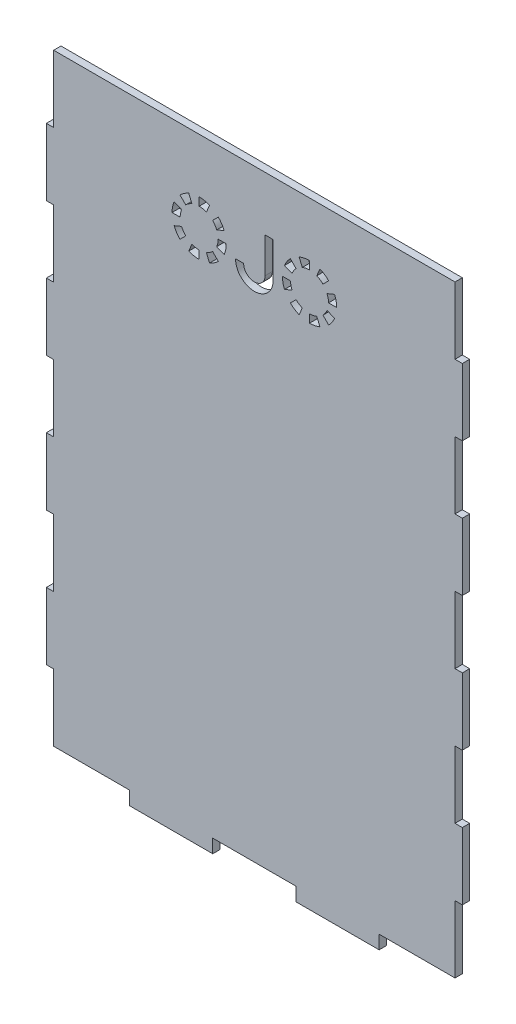
from build123d import *

# Parameters (mm, degrees)
BOSS_EXTRUDE2_DEPTH = 2.7


with BuildPart() as part:
    # Sketch1 → Boss-Extrude2 (new body)
    with BuildSketch(Plane.XY):
        Polygon((46.02, -108.65), (74, -108.65), (74, -83.95), (76.7, -83.95), (76.7, -59.25), (74, -59.25), (74, -34.55), (76.7, -34.55), (76.7, -9.85), (74, -9.85), (74, 14.85), (76.7, 14.85), (76.7, 39.55), (74, 39.55), (74, 64.25), (76.7, 64.25), (76.7, 88.95), (74, 88.95), (74, 113.65), (-74, 113.65), (-74, 88.95), (-76.7, 88.95), (-76.7, 64.25), (-74, 64.25), (-74, 39.55), (-76.7, 39.55), (-76.7, 14.85), (-74, 14.85), (-74, -9.85), (-76.7, -9.85), (-76.7, -34.55), (-74, -34.55), (-74, -59.25), (-76.7, -59.25), (-76.7, -61.75), (-76.7, -83.95), (-74, -83.95), (-74, -108.65), (-46.02, -108.65), (-46.02, -113.65), (-15.34, -113.65), (-15.34, -108.65), (15.34, -108.65), (15.34, -113.65), (46.02, -113.65), align=None)
        with BuildLine():
            Line((-13.280766207, 76.578932188), (-15.402086551, 78.700252532))
            ThreePointArc((-15.402086551, 78.700252532), (-16.462842388, 77.829712714), (-17.673049993, 77.182843272))
            Line((-17.673049993, 77.182843272), (-16.524999695, 74.411204675))
            ThreePointArc((-16.524999695, 74.411204675), (-14.796131689, 75.335303877), (-13.280766207, 76.578932188))
        make_face(mode=Mode.SUBTRACT)
        with BuildLine():
            Line((-11.113038694, 79.823165676), (-13.884677292, 80.971215973))
            ThreePointArc((-13.884677292, 80.971215973), (-13.486337056, 82.284367746), (-13.351834019, 83.65))
            Line((-13.351834019, 83.65), (-10.351834019, 83.65))
            ThreePointArc((-10.351834019, 83.65), (-10.543981215, 81.69909678), (-11.113038694, 79.823165676))
        make_face(mode=Mode.SUBTRACT)
        with BuildLine():
            Line((-11.113038694, 87.476834324), (-13.884677292, 86.328784027))
            ThreePointArc((-13.884677292, 86.328784027), (-14.531546733, 87.538991631), (-15.402086551, 88.599747468))
            Line((-15.402086551, 88.599747468), (-13.280766207, 90.721067812))
            ThreePointArc((-13.280766207, 90.721067812), (-12.037137896, 89.20570233), (-11.113038694, 87.476834324))
        make_face(mode=Mode.SUBTRACT)
        with BuildLine():
            Line((-16.524999695, 92.888795325), (-17.673049993, 90.117156728))
            ThreePointArc((-17.673049993, 90.117156728), (-18.986201765, 90.515496963), (-20.351834019, 90.65))
            Line((-20.351834019, 90.65), (-20.351834019, 93.65))
            ThreePointArc((-20.351834019, 93.65), (-18.400930799, 93.457852804), (-16.524999695, 92.888795325))
        make_face(mode=Mode.SUBTRACT)
        with BuildLine():
            Line((-23.030618046, 90.117156728), (-24.178668343, 92.888795325))
            ThreePointArc((-24.178668343, 92.888795325), (-25.907536349, 91.964696123), (-27.422901831, 90.721067812))
            Line((-27.422901831, 90.721067812), (-25.301581487, 88.599747468))
            ThreePointArc((-25.301581487, 88.599747468), (-24.24082565, 89.470287286), (-23.030618046, 90.117156728))
        make_face(mode=Mode.SUBTRACT)
        with BuildLine():
            Line((-26.818990747, 86.328784027), (-29.590629344, 87.476834324))
            ThreePointArc((-29.590629344, 87.476834324), (-30.159686823, 85.60090322), (-30.351834019, 83.65))
            Line((-30.351834019, 83.65), (-27.351834019, 83.65))
            ThreePointArc((-27.351834019, 83.65), (-27.217330982, 85.015632254), (-26.818990747, 86.328784027))
        make_face(mode=Mode.SUBTRACT)
        with BuildLine():
            Line((-26.818990747, 80.971215973), (-29.590629344, 79.823165676))
            ThreePointArc((-29.590629344, 79.823165676), (-28.666530142, 78.09429767), (-27.422901831, 76.578932188))
            Line((-27.422901831, 76.578932188), (-25.301581487, 78.700252532))
            ThreePointArc((-25.301581487, 78.700252532), (-26.172121305, 79.761008369), (-26.818990747, 80.971215973))
        make_face(mode=Mode.SUBTRACT)
        with BuildLine():
            Line((-23.030618046, 77.182843272), (-24.178668343, 74.411204675))
            ThreePointArc((-24.178668343, 74.411204675), (-22.302737239, 73.842147196), (-20.351834019, 73.65))
            Line((-20.351834019, 73.65), (-20.351834019, 76.65))
            ThreePointArc((-20.351834019, 76.65), (-21.717466273, 76.784503037), (-23.030618046, 77.182843272))
        make_face(mode=Mode.SUBTRACT)
        with BuildLine():
            Line((23.030618046, 77.182843272), (24.178668343, 74.411204675))
            ThreePointArc((24.178668343, 74.411204675), (22.302737239, 73.842147196), (20.351834019, 73.65))
            Line((20.351834019, 73.65), (20.351834019, 76.65))
            ThreePointArc((20.351834019, 76.65), (21.717466273, 76.784503037), (23.030618046, 77.182843272))
        make_face(mode=Mode.SUBTRACT)
        with BuildLine():
            Line((26.818990747, 80.971215973), (29.590629344, 79.823165676))
            ThreePointArc((29.590629344, 79.823165676), (28.666530142, 78.09429767), (27.422901831, 76.578932188))
            Line((27.422901831, 76.578932188), (25.301581487, 78.700252532))
            ThreePointArc((25.301581487, 78.700252532), (26.172121305, 79.761008369), (26.818990747, 80.971215973))
        make_face(mode=Mode.SUBTRACT)
        with BuildLine():
            Line((26.818990747, 86.328784027), (29.590629344, 87.476834324))
            ThreePointArc((29.590629344, 87.476834324), (30.159686823, 85.60090322), (30.351834019, 83.65))
            Line((30.351834019, 83.65), (27.351834019, 83.65))
            ThreePointArc((27.351834019, 83.65), (27.217330982, 85.015632254), (26.818990747, 86.328784027))
        make_face(mode=Mode.SUBTRACT)
        with BuildLine():
            Line((23.030618046, 90.117156728), (24.178668343, 92.888795325))
            ThreePointArc((24.178668343, 92.888795325), (25.907536349, 91.964696123), (27.422901831, 90.721067812))
            Line((27.422901831, 90.721067812), (25.301581487, 88.599747468))
            ThreePointArc((25.301581487, 88.599747468), (24.24082565, 89.470287286), (23.030618046, 90.117156728))
        make_face(mode=Mode.SUBTRACT)
        with BuildLine():
            Line((16.524999695, 92.888795325), (17.673049993, 90.117156728))
            ThreePointArc((17.673049993, 90.117156728), (18.986201765, 90.515496963), (20.351834019, 90.65))
            Line((20.351834019, 90.65), (20.351834019, 93.65))
            ThreePointArc((20.351834019, 93.65), (18.400930799, 93.457852804), (16.524999695, 92.888795325))
        make_face(mode=Mode.SUBTRACT)
        with BuildLine():
            Line((11.113038694, 87.476834324), (13.884677292, 86.328784027))
            ThreePointArc((13.884677292, 86.328784027), (14.531546733, 87.538991631), (15.402086551, 88.599747468))
            Line((15.402086551, 88.599747468), (13.280766207, 90.721067812))
            ThreePointArc((13.280766207, 90.721067812), (12.037137896, 89.20570233), (11.113038694, 87.476834324))
        make_face(mode=Mode.SUBTRACT)
        with BuildLine():
            Line((11.113038694, 79.823165676), (13.884677292, 80.971215973))
            ThreePointArc((13.884677292, 80.971215973), (13.486337056, 82.284367746), (13.351834019, 83.65))
            Line((13.351834019, 83.65), (10.351834019, 83.65))
            ThreePointArc((10.351834019, 83.65), (10.543981215, 81.69909678), (11.113038694, 79.823165676))
        make_face(mode=Mode.SUBTRACT)
        with BuildLine():
            Line((13.280766207, 76.578932188), (15.402086551, 78.700252532))
            ThreePointArc((15.402086551, 78.700252532), (16.462842388, 77.829712714), (17.673049993, 77.182843272))
            Line((17.673049993, 77.182843272), (16.524999695, 74.411204675))
            ThreePointArc((16.524999695, 74.411204675), (14.796131689, 75.335303877), (13.280766207, 76.578932188))
        make_face(mode=Mode.SUBTRACT)
        with BuildLine():
            Line((-6.942099487, 80.593058748), (-3.939040672, 80.593058748))
            ThreePointArc((-3.939040672, 80.593058748), (0.000959328, 76.653058748), (3.940959328, 80.593058748))
            Line((3.940959328, 80.593058748), (3.930401386, 93.65))
            Line((3.930401386, 93.65), (6.944018143, 93.65))
            Line((6.944018143, 93.65), (6.944018143, 80.593058748))
            ThreePointArc((6.944018143, 80.593058748), (0.000959328, 73.649999934), (-6.942099487, 80.593058748))
        make_face(mode=Mode.SUBTRACT)
    extrude(amount=BOSS_EXTRUDE2_DEPTH)


solid = part.part
